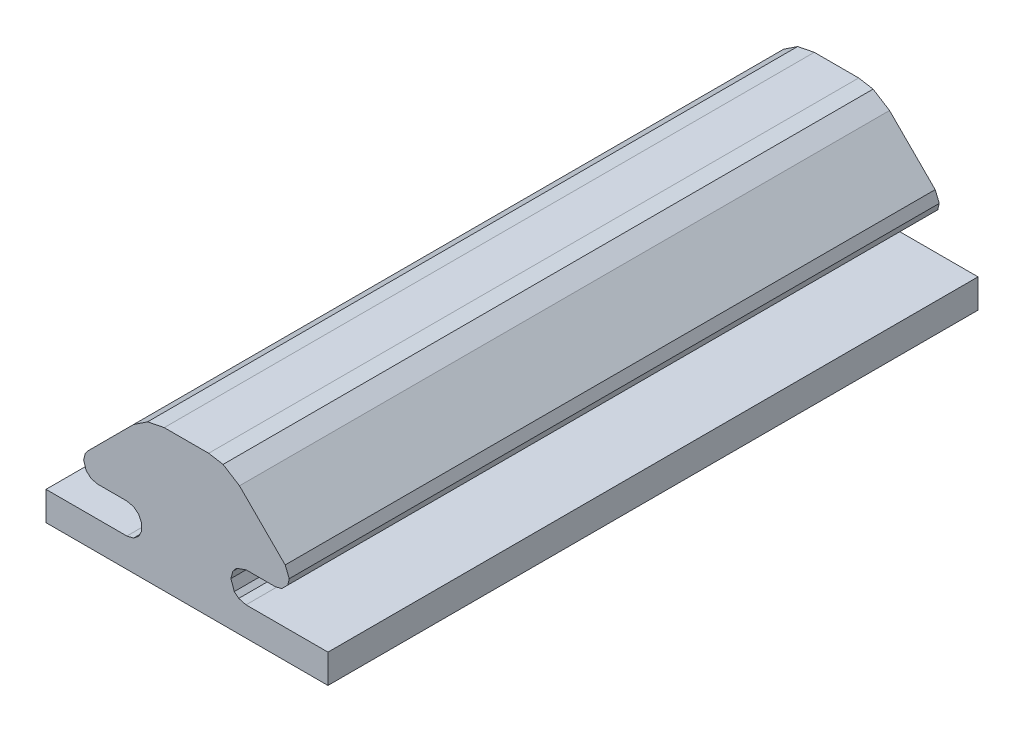
from build123d import *

# Parameters (mm, degrees)
BOSS_EXTRUDE1_DEPTH = 47.371
SKETCH18_W          = 20.1422
SKETCH18_H          = 47.371
CUT_EXTRUDE8_DEPTH  = 2.286
SKETCH20_W          = 47.405316282
SKETCH20_H          = 4.009576116
CUT_EXTRUDE9_DEPTH  = 0.2794
SKETCH21_W          = 47.371
SKETCH21_H          = 4.009576116
BOSS_EXTRUDE2_DEPTH = 0.6858
SKETCH23_W          = 20.5486
SKETCH23_H          = 47.371
CUT_EXTRUDE11_DEPTH = 1.905


with BuildPart() as part:
    # Sketch5 → Boss-Extrude1 (new body)
    with BuildSketch(Plane.XY):
        Polygon((-6.474794456, -10.4902), (-6.938297275, -10.378313453), (-7.308763147, -10.05450356), (-7.490794456, -9.4742), (-7.378907909, -9.01069718), (-7.193214945, -8.75577951), (-3.863171405, -5.42573597), (-2.833127272, -4.737482484), (-1.618107374, -4.4958), (1.618107374, -4.4958), (2.668236067, -4.674493152), (3.863171405, -5.42573597), (7.193214945, -8.75577951), (7.490794456, -9.4742), (7.378907909, -9.93770282), (6.938297275, -10.378313453), (6.474794456, -10.4902), (4.3434, -10.4902), (3.646537163, -10.737670005), (3.377082754, -11.059343535), (3.2385, -11.5951), (3.485970005, -12.291962837), (3.807643535, -12.561417246), (4.3434, -12.7), (10.5918, -12.7), (10.5918, -18.995576116), (-9.5504, -18.995576116), (-9.5504, -12.7), (-4.3434, -12.7), (-3.863171405, -12.590180165), (-3.485969976, -12.291962837), (-3.271081829, -11.861441531), (-3.271081829, -11.328758469), (-3.485969976, -10.898237163), (-3.863171405, -10.600019835), (-4.3434, -10.4902), align=None)
    extrude(amount=-BOSS_EXTRUDE1_DEPTH)

    # Sketch18 → Cut-Extrude8 (cut)
    with BuildSketch(Plane.XZ.offset(18.995576116)):
        with Locations((0.5207, -23.6855)):
            Rectangle(SKETCH18_W, SKETCH18_H)
    extrude(amount=-CUT_EXTRUDE8_DEPTH, mode=Mode.SUBTRACT)

    # Sketch20 → Cut-Extrude9 (cut)
    with BuildSketch(Plane(origin=(10.5918, 0, 0), x_dir=(0, 0, -1), z_dir=(1, 0, 0))):
        with Locations((23.668341859, -14.704788058)):
            Rectangle(SKETCH20_W, SKETCH20_H)
    extrude(amount=-CUT_EXTRUDE9_DEPTH, mode=Mode.SUBTRACT)

    # Sketch21 → Boss-Extrude2 (add)
    with BuildSketch(Plane.ZY.offset(9.5504)):
        with Locations((-23.6855, -14.704788058)):
            Rectangle(SKETCH21_W, SKETCH21_H)
    extrude(amount=BOSS_EXTRUDE2_DEPTH)

    # Sketch23 → Cut-Extrude11 (cut)
    with BuildSketch(Plane.XZ.offset(16.709576116)):
        with Locations((0.0381, -23.6855)):
            Rectangle(SKETCH23_W, SKETCH23_H)
    extrude(amount=-CUT_EXTRUDE11_DEPTH, mode=Mode.SUBTRACT)


solid = part.part
